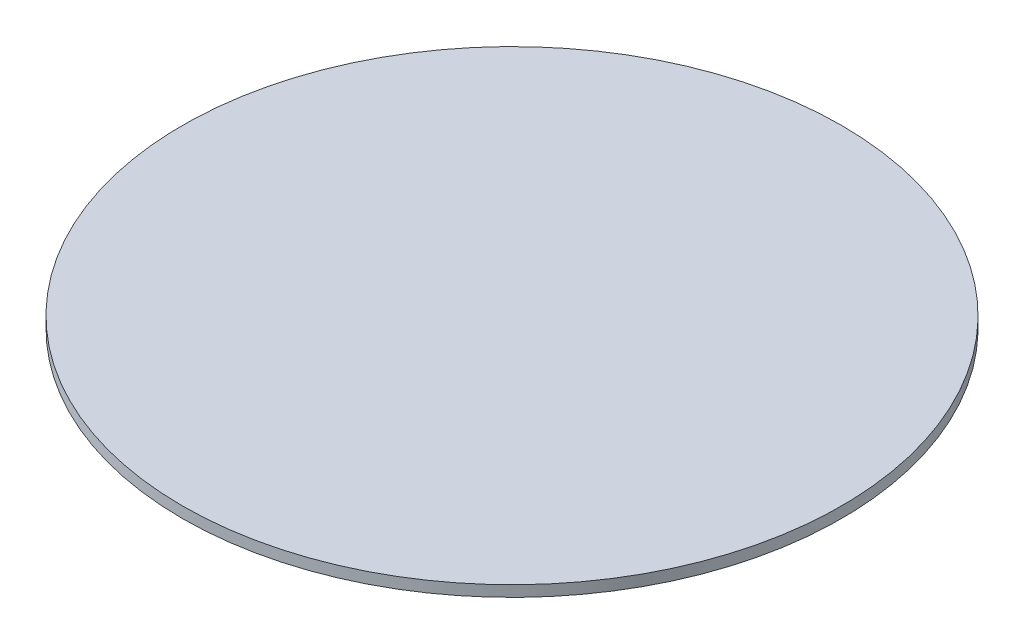
from build123d import *

# Parameters (mm, degrees)
SKETCH1_R           = 76.2
BOSS_EXTRUDE1_DEPTH = 2.54


with BuildPart() as part:
    # Sketch1 → Boss-Extrude1 (new body)
    with BuildSketch(Plane(origin=(0, 0, 0), x_dir=(1, 0, 0), z_dir=(0, 1, 0))):
        Circle(SKETCH1_R)
    extrude(amount=BOSS_EXTRUDE1_DEPTH)


solid = part.part
